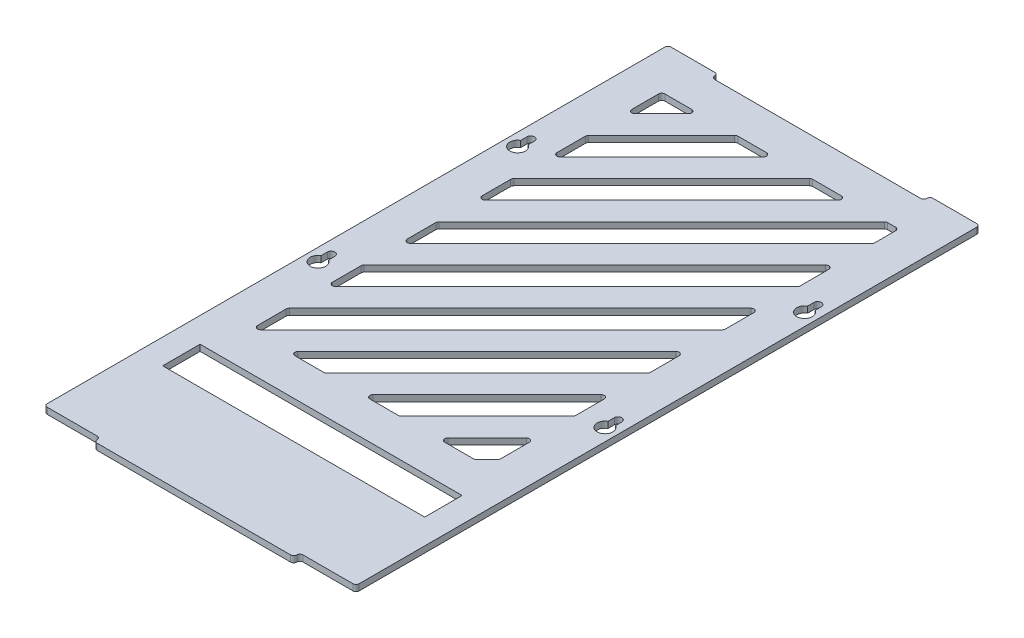
from build123d import *

# Parameters (mm, degrees)
BOSS_EXTRUDE1_DEPTH  = 3.175
SKETCH2_W            = 107.95
SKETCH2_H            = 3.175
CUT_EXTRUDE1_DEPTH   = 355.989990176
SKETCH3_W            = 133.35
SKETCH3_H            = 19.05
CUT_EXTRUDE2_DEPTH   = 355.989990176
FILLET1_R            = 1.5875
CUT_EXTRUDE3_DEPTH   = 355.989990176
LPATTERN1_COUNT      = 2
LPATTERN1_PITCH      = 101.6
LPATTERN1_COUNT_DIR2 = 2
LPATTERN1_PITCH_DIR2 = 146.05
CUT_EXTRUDE4_DEPTH   = 355.989990176
FILLET2_R            = 1.5875


with BuildPart() as part:
    # Sketch1 → Boss-Extrude1 (new body)
    with BuildSketch(Plane(origin=(0, 0, 0), x_dir=(1, 0, 0), z_dir=(0, 1, 0))):
        Polygon((130.175, 0), (158.75, 0), (158.75, 317.5), (0, 317.5), (0, 0), (28.575, 0), (28.575, -3.175), (130.175, -3.175), align=None)
    extrude(amount=BOSS_EXTRUDE1_DEPTH)

    # Sketch2 → Cut-Extrude1 (cut, through all)
    with BuildSketch(Plane(origin=(0, 3.175, 0), x_dir=(1, 0, 0), z_dir=(0, 1, 0))):
        with Locations((79.375, 315.9125)):
            Rectangle(SKETCH2_W, SKETCH2_H)
    extrude(amount=-CUT_EXTRUDE1_DEPTH, mode=Mode.SUBTRACT)

    # Sketch3 → Cut-Extrude2 (cut, through all)
    with BuildSketch(Plane(origin=(0, 3.175, 0), x_dir=(1, 0, 0), z_dir=(0, 1, 0))):
        with Locations((79.375, 57.15)):
            Rectangle(SKETCH3_W, SKETCH3_H)
    extrude(amount=-CUT_EXTRUDE2_DEPTH, mode=Mode.SUBTRACT)

    # Fillet1
    fillet1_edges = [part.edges().sort_by_distance(p)[0] for p in [
        (25.4, 1.5875, -314.325),
        (25.4, 1.5875, -317.5),
        (0, 1.5875, -317.5),
        (0, 1.5875, 0),
        (28.575, 1.5875, 0),
        (28.575, 1.5875, 3.175),
        (130.175, 1.5875, 3.175),
        (130.175, 1.5875, 0),
        (158.75, 1.5875, 0),
        (158.75, 1.5875, -317.5),
        (133.35, 1.5875, -317.5),
        (133.35, 1.5875, -314.325),
    ]]
    fillet(fillet1_edges, radius=FILLET1_R - 0.0001)  # a hair under: the kernel refuses the full size

    # Sketch4 → Cut-Extrude3 (cut, through all)
    with BuildSketch(Plane(origin=(0, 3.175, 0), x_dir=(1, 0, 0), z_dir=(0, 1, 0))):
        with BuildLine():
            Line((4.445, 238.114159312), (4.445, 241.3))
            ThreePointArc((4.445, 241.3), (6.35, 243.205), (8.255, 241.3))
            Line((8.255, 241.3), (8.255, 238.114159312))
            ThreePointArc((8.255, 238.114159312), (6.35, 230.66375), (4.445, 238.114159312))
        make_face()
    cut_extrude3 = extrude(amount=-CUT_EXTRUDE3_DEPTH, mode=Mode.SUBTRACT)

    # LPattern1: Cut-Extrude3 2 × 2
    with Locations(*[(j * LPATTERN1_PITCH_DIR2, 0, i * LPATTERN1_PITCH) for i in range(LPATTERN1_COUNT) for j in range(LPATTERN1_COUNT_DIR2) if (i, j) != (0, 0)]):
        add(cut_extrude3, mode=Mode.SUBTRACT)

    # Sketch5 → Cut-Extrude4 (cut, through all)
    with BuildSketch(Plane(origin=(0, 3.175, 0), x_dir=(1, 0, 0), z_dir=(0, 1, 0))):
        Polygon((139.7, 111.125), (114.3, 85.725), (133.35, 85.725), (139.7, 92.075), align=None)
        Polygon((139.7, 149.225), (76.2, 85.725), (95.25, 85.725), (139.7, 130.175), align=None)
        Polygon((139.7, 187.325), (38.1, 85.725), (57.15, 85.725), (139.7, 168.275), align=None)
        Polygon((19.05, 104.775), (19.05, 85.725), (139.7, 206.375), (139.7, 225.425), align=None)
        Polygon((19.05, 142.875), (19.05, 123.825), (139.7, 244.475), (139.7, 263.525), align=None)
        Polygon((19.05, 180.975), (19.05, 161.925), (139.7, 282.575), (139.7, 295.275), (133.35, 295.275), align=None)
        Polygon((19.05, 219.075), (19.05, 200.025), (114.3, 295.275), (95.25, 295.275), align=None)
        Polygon((19.05, 257.175), (19.05, 238.125), (76.2, 295.275), (57.15, 295.275), align=None)
        Polygon((19.05, 295.275), (19.05, 276.225), (38.1, 295.275), align=None)
    extrude(amount=-CUT_EXTRUDE4_DEPTH, mode=Mode.SUBTRACT)

    # Fillet2
    fillet2_edges = [part.edges().sort_by_distance(p)[0] for p in [
        (19.05, 1.5875, -104.775),
        (139.7, 1.5875, -225.425),
        (139.7, 1.5875, -206.375),
        (19.05, 1.5875, -85.725),
        (19.05, 1.5875, -142.875),
        (139.7, 1.5875, -263.525),
        (139.7, 1.5875, -244.475),
        (19.05, 1.5875, -123.825),
        (95.25, 1.5875, -85.725),
        (76.2, 1.5875, -85.725),
        (139.7, 1.5875, -149.225),
        (139.7, 1.5875, -130.175),
        (57.15, 1.5875, -85.725),
        (38.1, 1.5875, -85.725),
        (139.7, 1.5875, -187.325),
        (139.7, 1.5875, -168.275),
        (19.05, 1.5875, -257.175),
        (57.15, 1.5875, -295.275),
        (76.2, 1.5875, -295.275),
        (19.05, 1.5875, -238.125),
        (19.05, 1.5875, -276.225),
        (19.05, 1.5875, -295.275),
        (38.1, 1.5875, -295.275),
        (19.05, 1.5875, -180.975),
        (133.35, 1.5875, -295.275),
        (139.7, 1.5875, -295.275),
        (139.7, 1.5875, -282.575),
        (19.05, 1.5875, -161.925),
        (19.05, 1.5875, -219.075),
        (95.25, 1.5875, -295.275),
        (114.3, 1.5875, -295.275),
        (19.05, 1.5875, -200.025),
        (133.35, 1.5875, -85.725),
        (114.3, 1.5875, -85.725),
        (139.7, 1.5875, -111.125),
        (139.7, 1.5875, -92.075),
    ]]
    fillet(fillet2_edges, radius=FILLET2_R)


solid = part.part
